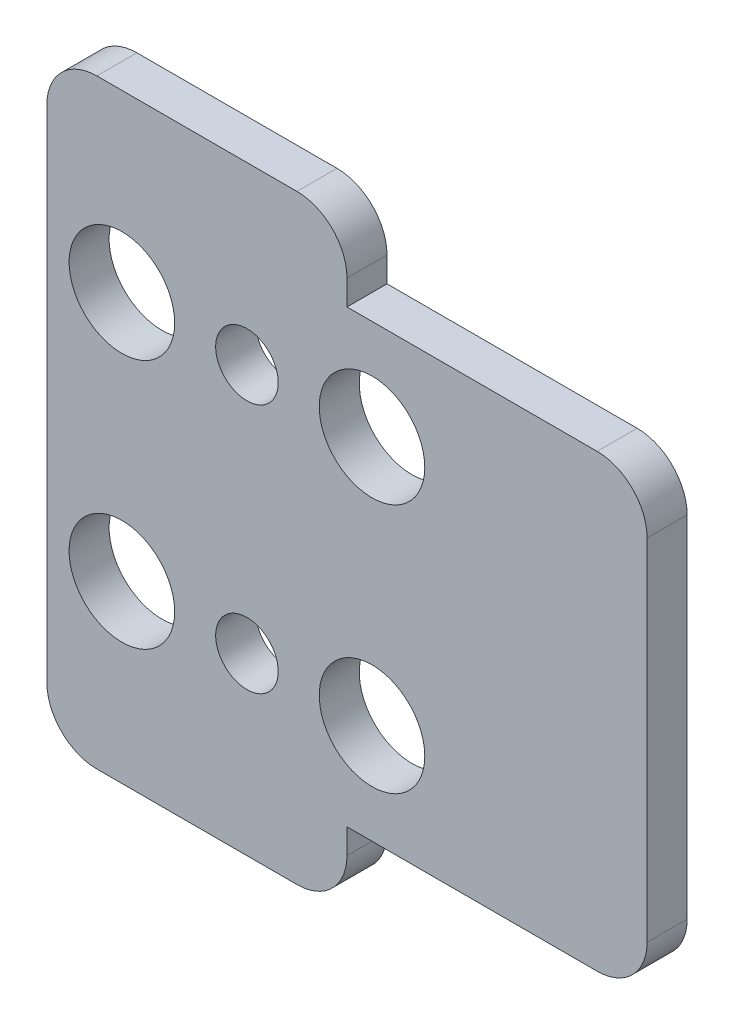
from build123d import *

# Parameters (mm, degrees)
SKETCH_1_R      = 2.11
SKETCH_1_R_2    = 1.25
EXTRUDE_1_DEPTH = 1.6
FILLET_1_R      = 2


with BuildPart() as part:
    # 草图1 → 凸台-拉伸1 (new body)
    with BuildSketch(Plane.XY):
        Polygon((12, 0), (0, 0), (0, -24), (12, -24), (12, -21), (24, -21), (24, -3), (12, -3), align=None)
        with Locations((13, -7)):
            Circle(SKETCH_1_R, mode=Mode.SUBTRACT)
        with Locations((13, -17)):
            Circle(SKETCH_1_R, mode=Mode.SUBTRACT)
        with Locations((3, -17)):
            Circle(SKETCH_1_R, mode=Mode.SUBTRACT)
        with Locations((8, -17)):
            Circle(SKETCH_1_R_2, mode=Mode.SUBTRACT)
        with Locations((3, -7)):
            Circle(SKETCH_1_R, mode=Mode.SUBTRACT)
        with Locations((8, -7)):
            Circle(SKETCH_1_R_2, mode=Mode.SUBTRACT)
    extrude(amount=EXTRUDE_1_DEPTH)

    # 圆角1
    fillet_1_edges = [part.edges().sort_by_distance(p)[0] for p in [
        (0, -24, 0.8),
        (12, -24, 0.8),
        (24, -21, 0.8),
        (24, -3, 0.8),
        (12, 0, 0.8),
        (0, 0, 0.8),
    ]]
    fillet(fillet_1_edges, radius=FILLET_1_R)


solid = part.part
